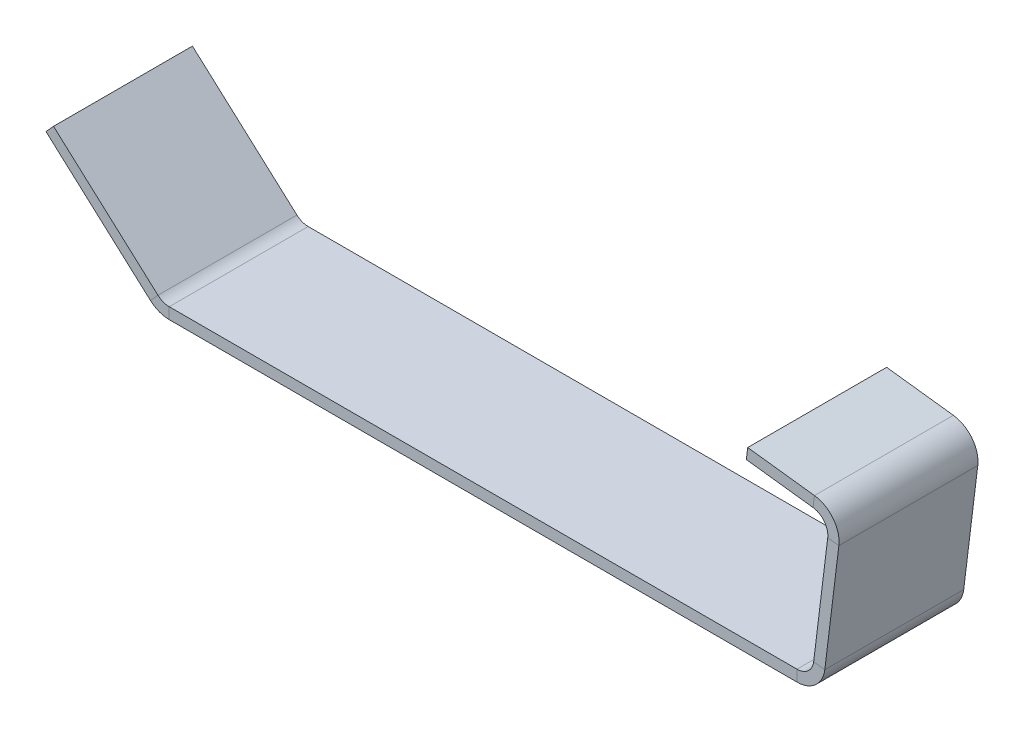
from build123d import *

# Parameters (mm, degrees)
SKETCH_1_W             = 112
SKETCH_1_H             = 24.788135593
SM_BASE_FLANGE_1_DEPTH = 2
SM_EDGE_FLANGE_1_DEPTH = 24.788135593
SM_EDGE_FLANGE_2_DEPTH = 24.788135593
SM_EDGE_FLANGE_3_DEPTH = 24.788135593


# Sheet-metal steps are written as plain solids
with BuildPart() as part:
    # Sketch 1 → Базовая кромка1 (new body)
    with BuildSketch(Plane(origin=(0, 0, 0), x_dir=(1, 0, 0), z_dir=(0, 1, 0))):
        with Locations((56, 12.394067796)):
            Rectangle(SKETCH_1_W, SKETCH_1_H)
    extrude(amount=-SM_BASE_FLANGE_1_DEPTH)

    # Ребро-кромка1 section (across the edge) → Ребро-кромка1 (add)
    with BuildSketch(Plane(origin=(114.654175794, 0, 0), x_dir=(-0.9925461516413217, 0.12186934340515113, 0), z_dir=(0, 0, -1))):
        with BuildLine():
            Line((-2, 2.654175794), (-2, 23.230549471))
            Line((-2, 23.230549471), (0, 23.230549471))
            Line((0, 23.230549471), (0, 2.654175794))
            ThreePointArc((0, 2.654175794), (0.753132838, 0.666315649), (2.63439197, -0.323462661))
            Line((2.63439197, -0.323462661), (2.390653283, -2.308554965))
            ThreePointArc((2.390653283, -2.308554965), (-0.744778604, -0.658924447), (-2, 2.654175794))
        make_face()
    extrude(amount=SM_EDGE_FLANGE_1_DEPTH)

    # Ребро-кромка2 section (across the edge) → Ребро-кромка2 (add)
    with BuildSketch(Plane(origin=(117.850875635, 26.035030933, 0), x_dir=(-0.12186934340515466, -0.9925461516413212, 0), z_dir=(0, 0, -1))):
        with BuildLine():
            Line((-2, 3), (-2, 15))
            Line((-2, 15), (0, 15))
            Line((0, 15), (0, 3))
            ThreePointArc((0, 3), (0.878679656, 0.878679656), (3, 0))
            Line((3, 0), (3, -2))
            ThreePointArc((3, -2), (-0.535533906, -0.535533906), (-2, 3))
        make_face()
    extrude(amount=SM_EDGE_FLANGE_2_DEPTH)

    # Ребро-кромка3 section (across the edge) → Ребро-кромка3 (add)
    with BuildSketch(Plane(origin=(-1.151592105, 0, -24.788135593), x_dir=(0.6691306063588548, 0.7431448254773974, 0), z_dir=(0, 0, 1))):
        with BuildLine():
            Line((-2, 1.151592105), (-2, 26.23227193))
            Line((-2, 26.23227193), (0, 26.23227193))
            Line((0, 26.23227193), (0, 1.151592105))
            ThreePointArc((0, 1.151592105), (0.199258721, 0.076488256), (0.770565524, -0.855799714))
            Line((0.770565524, -0.855799714), (-0.715724127, -2.194060927))
            ThreePointArc((-0.715724127, -2.194060927), (-1.667902132, -0.640247643), (-2, 1.151592105))
        make_face()
    extrude(amount=SM_EDGE_FLANGE_3_DEPTH)


solid = part.part
